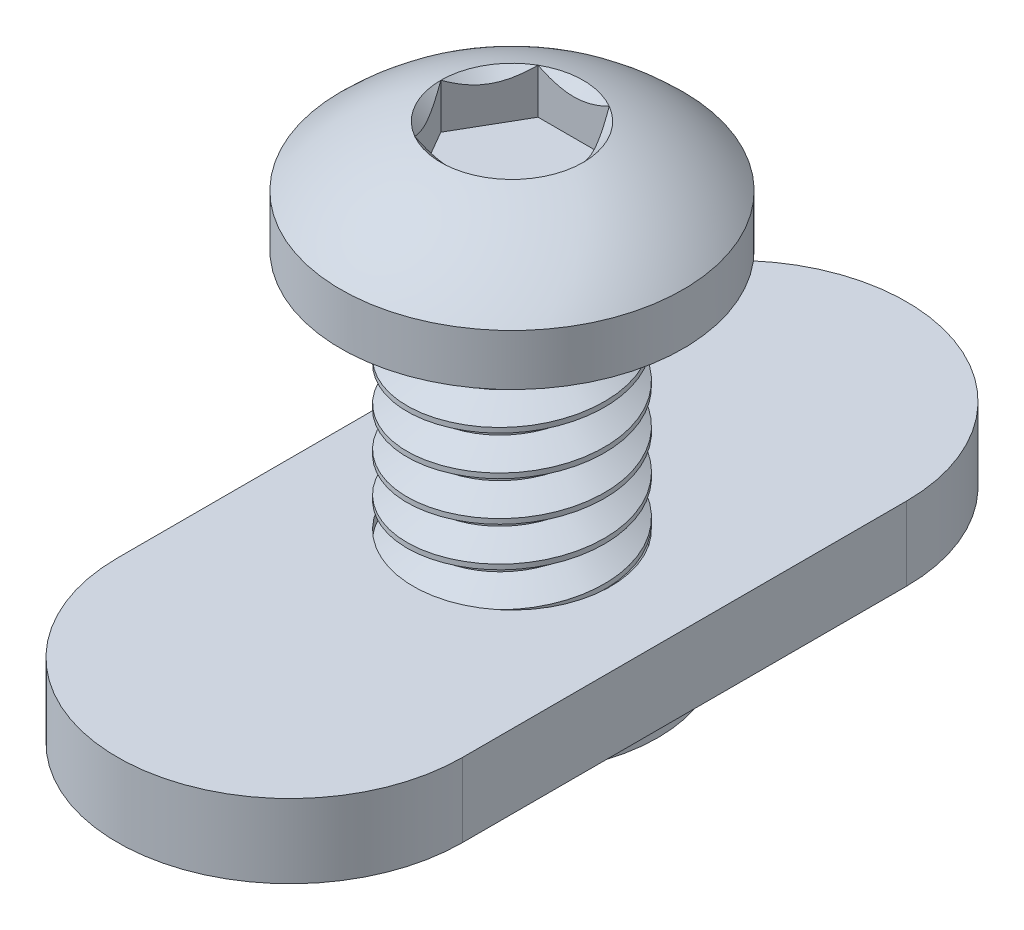
from build123d import *

# Parameters (mm, degrees)
SKETCH2_W                    = 3.175
SKETCH2_H                    = 12.7
CHAMFER1_SIZE                = 1.27
CUT_SWEEP1_PITCH             = 1.27
CUT_EXTRUDE1_DEPTH           = 1.984375
SKETCH7_R                    = 2.291358881
CUT_EXTRUDE2_DEPTH           = 1.449114
CUT_EXTRUDE2_TAPER           = 45
CUT_EXTRUDE2_OTHER_WAY_DEPTH = 19.049467824
SKETCH8_R                    = 3.175
EXTRUDE1_DEPTH               = 1.7272
SKETCH9_R                    = 4.699
CUT_EXTRUDE3_DEPTH           = 1.0795


with BuildPart() as part:
    # Sketch2 → Revolve2 (revolve)
    with BuildSketch(Plane.XY, mode=Mode.PRIVATE) as revolve2_sk:
        with Locations((-1.5875, 6.35)):
            Rectangle(SKETCH2_W, SKETCH2_H)
    revolve(revolve2_sk.sketch.rotate(Axis((0, 0, 0), (0, 1, 0)), 270), axis=Axis((0, 0, 0), (0, 1, 0)))

    # Chamfer1
    chamfer1_edges = [part.edges().sort_by_distance(p)[0] for p in [
        (0, 0, 3.175),
    ]]
    chamfer(chamfer1_edges, length=CHAMFER1_SIZE)

    # Cut-Sweep1: the profile of Sketch4 profile screwed along a right-hand helix of 13.75 turns, 6 arcs to a turn; built about Z, then put on its axis
    cut_sweep1_z = Axis((0, 0, 0), (0, 0, 1))
    cut_sweep1_corners = [(3.1753, 0, -1.111423205), (3.1753, 0, 0.000173205), (2.350110803, 0, -0.47625), (2.350110803, 0, -0.635)]
    with BuildLine(mode=Mode.PRIVATE) as cut_sweep1_profile:
        Line(cut_sweep1_corners[0], cut_sweep1_corners[1])
        Line(cut_sweep1_corners[1], cut_sweep1_corners[2])
        Line(cut_sweep1_corners[2], cut_sweep1_corners[3])
        Line(cut_sweep1_corners[3], cut_sweep1_corners[0])
    cut_sweep1_cap = Face(cut_sweep1_profile.wire())
    cut_sweep1_turn_angles = [0, 30, 60, 90, 120, 150, 180, 210, 240, 270, 300, 330, 360]
    cut_sweep1_turn_weights = [1, 0.8660254037844387, 1, 0.8660254037844387, 1, 0.8660254037844387, 1, 0.8660254037844387, 1, 0.8660254037844387, 1, 0.8660254037844387, 1]
    cut_sweep1_turn_rails = [Edge.make_bspline([Vector(p[0], p[1], 0).rotate(cut_sweep1_z, cut_sweep1_turn_angles[k]) / cut_sweep1_turn_weights[k] + Vector(0, 0, p[2] + CUT_SWEEP1_PITCH * cut_sweep1_turn_angles[k] / 360) for k in range(13)], [0, 0, 0, 1, 1, 2, 2, 3, 3, 4, 4, 5, 5, 6, 6, 6], 2, cut_sweep1_turn_weights) for p in cut_sweep1_corners]
    cut_sweep1_turn_sides = [Face.make_surface_from_curves(cut_sweep1_turn_rails[p[0]], cut_sweep1_turn_rails[p[1]]) for p in [(0, 1), (1, 2), (2, 3), (3, 0)]]
    cut_sweep1_last_angles = [4680, 4710, 4740, 4770, 4800, 4830, 4860, 4890, 4920, 4935, 4950]
    cut_sweep1_last_weights = [1, 0.8660254037844387, 1, 0.8660254037844387, 1, 0.8660254037844387, 1, 0.8660254037844387, 1, 0.9659258262890539, 1]
    cut_sweep1_last_rails = [Edge.make_bspline([Vector(p[0], p[1], 0).rotate(cut_sweep1_z, cut_sweep1_last_angles[k]) / cut_sweep1_last_weights[k] + Vector(0, 0, p[2] + CUT_SWEEP1_PITCH * cut_sweep1_last_angles[k] / 360) for k in range(11)], [0, 0, 0, 1, 1, 2, 2, 3, 3, 4, 4, 5, 5, 5], 2, cut_sweep1_last_weights) for p in cut_sweep1_corners]
    cut_sweep1_last_sides = [Face.make_surface_from_curves(cut_sweep1_last_rails[p[0]], cut_sweep1_last_rails[p[1]]) for p in [(0, 1), (1, 2), (2, 3), (3, 0)]]
    cut_sweep1 = Plane(origin=(0, 12.7, 0), x_dir=(1, 0, 0), z_dir=(0, -1, 0)) * Solid(Shell([*[p.moved(Location((0, 0, CUT_SWEEP1_PITCH * i))) for i in range(13) for p in cut_sweep1_turn_sides], *cut_sweep1_last_sides, cut_sweep1_cap, cut_sweep1_cap.rotate(cut_sweep1_z, 4950).moved(Location((0, 0, CUT_SWEEP1_PITCH * 4950 / 360)))]))
    add(cut_sweep1, mode=Mode.SUBTRACT)

    # Sketch5 → Revolve3 (revolve)
    with BuildSketch(Plane.XY):
        with BuildLine():
            Line((0, 12.7), (0, 16.8148))
            ThreePointArc((0, 16.8148), (-2.526783012, 16.155567191), (-4.40944, 14.34592))
            Line((-4.40944, 14.34592), (-5.5118, 14.34592))
            Line((-5.5118, 14.34592), (-5.5118, 12.7))
            Line((-5.5118, 12.7), (0, 12.7))
        make_face()
    revolve(axis=Axis((0, 0, 0), (0, 1, 0)))

    # Sketch6 → Cut-Extrude1 (cut)
    with BuildSketch(Plane(origin=(0, 16.8148, 0), x_dir=(-1, 0, 0), z_dir=(0, 1, 0))):
        Polygon((1.14567944, 1.984375), (-1.14567944, 1.984375), (-2.291358881, 0), (-1.14567944, -1.984375), (1.14567944, -1.984375), (2.291358881, 0), align=None)
    extrude(amount=-CUT_EXTRUDE1_DEPTH, mode=Mode.SUBTRACT)

    # Sketch7 → Cut-Extrude2 (cut)
    with BuildSketch(Plane(origin=(0, 16.279539453, 0), x_dir=(-1, 0, 0), z_dir=(0, 1, 0))):
        Circle(SKETCH7_R)
    extrude(amount=-CUT_EXTRUDE2_DEPTH, taper=CUT_EXTRUDE2_TAPER, mode=Mode.SUBTRACT)

    # Sketch7 → Cut-Extrude2 other way (cut)
    with BuildSketch(Plane(origin=(0, 16.279539453, 0), x_dir=(-1, 0, 0), z_dir=(0, 1, 0))):
        Circle(SKETCH7_R)
    extrude(amount=CUT_EXTRUDE2_OTHER_WAY_DEPTH, mode=Mode.SUBTRACT)

    # Sketch15 → Revolve5 (revolve)
    with BuildSketch(Plane.XY):
        with BuildLine():
            Line((-5.5118, 14.34592), (-4.40944, 14.34592))
            ThreePointArc((-4.40944, 14.34592), (-3.487104452, 15.462475998), (-2.291358881, 16.279539453))
            ThreePointArc((-2.291358881, 16.279539453), (-4.019582463, 15.509263634), (-5.5118, 14.34592))
        make_face()
    revolve(axis=Axis((0, 0, 0), (0, 1, 0)))


with BuildPart() as body_2:
    # Sketch8 → Extrude1 (new, symmetric)
    with BuildSketch(Plane.XZ.offset(-3.175)):
        with BuildLine():
            Line((-5.55625, 7.14375), (-5.55625, -7.14375))
            ThreePointArc((-5.55625, -7.14375), (0, -12.7), (5.55625, -7.14375))
            Line((5.55625, -7.14375), (5.55625, 7.14375))
            ThreePointArc((5.55625, 7.14375), (0, 12.7), (-5.55625, 7.14375))
        make_face()
        with Locations(Location((0, 0, 0), (0, 0, 270))):
            Circle(SKETCH8_R, mode=Mode.SUBTRACT)
    extrude(amount=EXTRUDE1_DEPTH, both=True)

    # Sketch9 → Cut-Extrude3 (cut)
    with BuildSketch(Plane.XZ.offset(-1.4478)):
        with BuildLine():
            Line((5.55625, -7.14375), (5.55625, 7.14375))
            ThreePointArc((5.55625, 7.14375), (0, 12.7), (-5.55625, 7.14375))
            Line((-5.55625, 7.14375), (-5.55625, -7.14375))
            ThreePointArc((-5.55625, -7.14375), (0, -12.7), (5.55625, -7.14375))
        make_face()
        with Locations(Location((0, 0, 0), (0, 0, 270))):
            Circle(SKETCH9_R, mode=Mode.SUBTRACT)
    extrude(amount=-CUT_EXTRUDE3_DEPTH, mode=Mode.SUBTRACT)


solid = Compound([part.part, body_2.part])
